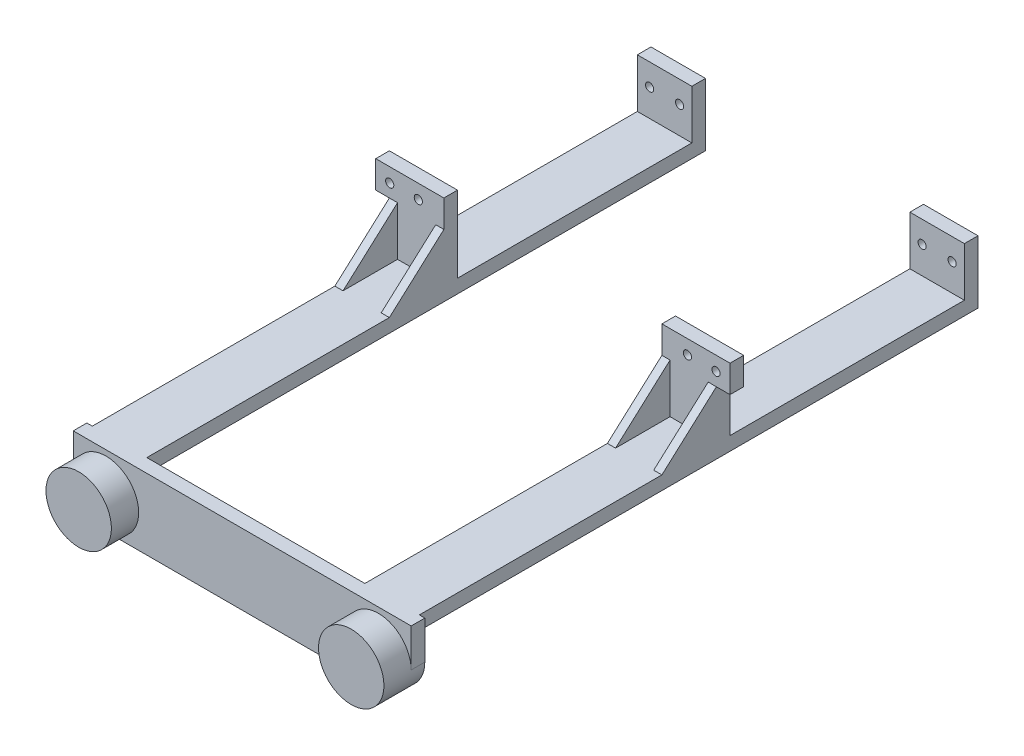
from build123d import *

# Parameters (mm, degrees)
SKETCH1_W               = 130
SKETCH1_H               = 24
BOSS_EXTRUDE1_DEPTH     = 5
CUT_EXTRUDE1_DEPTH      = 133.291345144
CUT_EXTRUDE1_DEPTH_BACK = 133.291345144
SKETCH2_R               = 6.5
SKETCH3_R               = 12
BOSS_EXTRUDE3_DEPTH     = 10
SKETCH4_R               = 6.5
CUT_EXTRUDE2_DEPTH      = 5
CUT_EXTRUDE3_DEPTH      = 133.574507353
CUT_EXTRUDE3_DEPTH_BACK = 133.574507353
BOSS_EXTRUDE4_DEPTH     = 2
SKETCH7_W               = 20
SKETCH7_H               = 5
BOSS_EXTRUDE5_DEPTH     = 205
SKETCH8_W               = 20
SKETCH8_H               = 5
BOSS_EXTRUDE6_DEPTH     = 28
SKETCH9_W               = 20
SKETCH9_H               = 5
BOSS_EXTRUDE7_DEPTH     = 18
SKETCH10_W              = 5
SKETCH10_H              = 10
BOSS_EXTRUDE8_DEPTH     = 25
SKETCH11_W              = 5
SKETCH11_H              = 10
BOSS_EXTRUDE9_DEPTH     = 25
SKETCH12_R              = 1.5
CUT_EXTRUDE4_DEPTH      = 188.59530911
THICKEN1_T2             = 3
THICKEN2_START          = 22
THICKEN2_DEPTH          = 3
THICKEN3_START          = 5
THICKEN3_DEPTH          = 3
THICKEN4_START          = 105
THICKEN4_DEPTH          = 3
CUT_EXTRUDE5_REACH      = 258.984
SKETCH14_R              = 1.5


# Read off the part's stored shape, not the designer's step: Thicken2, Thicken3, Thicken4
with BuildPart() as part:
    # Sketch1 → Boss-Extrude1 (new body)
    with BuildSketch(Plane.XY):
        with Locations((65, 12)):
            Rectangle(SKETCH1_W, SKETCH1_H)
    extrude(amount=BOSS_EXTRUDE1_DEPTH)

    # Sketch2 → Cut-Extrude1 (cut, two sides: drawn at the far end of the back side and taken through both)
    with BuildSketch(Plane(origin=(0, 0, 0), x_dir=(-1, 0, 0), z_dir=(0, 0, -1)).offset(-CUT_EXTRUDE1_DEPTH_BACK)):
        with Locations((-15, 12)):
            Circle(SKETCH2_R)
        with Locations((-115, 12)):
            Circle(SKETCH2_R)
    extrude(amount=CUT_EXTRUDE1_DEPTH + CUT_EXTRUDE1_DEPTH_BACK, mode=Mode.SUBTRACT)

    # Sketch3 → Boss-Extrude3 (add)
    with BuildSketch(Plane.XY.offset(5)):
        with Locations(Location((15, 12, 0), (0, 0, 270))):
            Circle(SKETCH3_R)
        with Locations(Location((115, 12, 0), (0, 0, 270))):
            Circle(SKETCH3_R)
    extrude(amount=BOSS_EXTRUDE3_DEPTH)

    # Sketch4 → Cut-Extrude2 (cut)
    with BuildSketch(Plane(origin=(0, 0, 5), x_dir=(-1, 0, 0), z_dir=(0, 0, -1))):
        with Locations((-15, 12)):
            Circle(SKETCH4_R)
        with Locations((-115, 12)):
            Circle(SKETCH4_R)
    extrude(amount=-CUT_EXTRUDE2_DEPTH, mode=Mode.SUBTRACT)

    # Sketch5 → Cut-Extrude3 (cut, two sides: drawn at the far end of the back side and taken through both)
    with BuildSketch(Plane.XY.offset(5).offset(-CUT_EXTRUDE3_DEPTH_BACK)):
        with BuildLine():
            Line((3, 24), (0, 24))
            Line((0, 24), (0, 0))
            Line((0, 0), (15, 0))
            ThreePointArc((15, 0), (6.514718626, 3.514718626), (3, 12))
            Line((3, 12), (3, 24))
        make_face()
        with BuildLine():
            Line((115, 0), (130, 0))
            Line((130, 0), (130, 24))
            Line((130, 24), (127, 24))
            Line((127, 24), (127, 12))
            ThreePointArc((127, 12), (123.485281374, 3.514718626), (115, 0))
        make_face()
    extrude(amount=CUT_EXTRUDE3_DEPTH + CUT_EXTRUDE3_DEPTH_BACK, mode=Mode.SUBTRACT)

    # Sketch6 → Boss-Extrude4 (add)
    with BuildSketch(Plane(origin=(0, 24, 0), x_dir=(1, 0, 0), z_dir=(0, 1, 0))):
        Polygon((127, 0), (3, 0), (3, -5), (15, -5), (115, -5), (127, -5), align=None)
    extrude(amount=BOSS_EXTRUDE4_DEPTH)

    # Sketch7 → Boss-Extrude5 (add)
    with BuildSketch(Plane(origin=(0, 0, 0), x_dir=(-1, 0, 0), z_dir=(0, 0, -1))):
        with Locations((-115, 23.5)):
            Rectangle(SKETCH7_W, SKETCH7_H)
        with Locations((-15, 23.5)):
            Rectangle(SKETCH7_W, SKETCH7_H)
    extrude(amount=BOSS_EXTRUDE5_DEPTH)

    # Sketch8 → Boss-Extrude6 (add)
    with BuildSketch(Plane(origin=(0, 26, 0), x_dir=(1, 0, 0), z_dir=(0, 1, 0))):
        with Locations((115, 111.5)):
            Rectangle(SKETCH8_W, SKETCH8_H)
        with Locations((15, 111.5)):
            Rectangle(SKETCH8_W, SKETCH8_H)
    extrude(amount=BOSS_EXTRUDE6_DEPTH)

    # Sketch9 → Boss-Extrude7 (add)
    with BuildSketch(Plane(origin=(0, 26, 0), x_dir=(1, 0, 0), z_dir=(0, 1, 0))):
        with Locations((115, 202.5)):
            Rectangle(SKETCH9_W, SKETCH9_H)
        with Locations((15, 202.5)):
            Rectangle(SKETCH9_W, SKETCH9_H)
    extrude(amount=BOSS_EXTRUDE7_DEPTH)

    # Sketch10 → Boss-Extrude8 (add)
    with BuildSketch(Plane.ZY.offset(-105)):
        with Locations((-111.5, 49)):
            Rectangle(SKETCH10_W, SKETCH10_H)
    extrude(amount=-BOSS_EXTRUDE8_DEPTH)

    # Sketch11 → Boss-Extrude9 (add)
    with BuildSketch(Plane(origin=(25, 0, 0), x_dir=(0, 0, -1), z_dir=(1, 0, 0))):
        with Locations((111.5, 49)):
            Rectangle(SKETCH11_W, SKETCH11_H)
    extrude(amount=-BOSS_EXTRUDE9_DEPTH)

    # Sketch12 → Cut-Extrude4 (cut, through all)
    with BuildSketch(Plane.XY.offset(-109)):
        with Locations((124.874085346, 48.801077027)):
            Circle(SKETCH12_R)
        with Locations((114.374085346, 48.801077027)):
            Circle(SKETCH12_R)
        with Locations((15.624085346, 48.801077027)):
            Circle(SKETCH12_R)
        with Locations((5.124085346, 48.801077027)):
            Circle(SKETCH12_R)
    extrude(amount=-CUT_EXTRUDE4_DEPTH, mode=Mode.SUBTRACT)

    # Sketch13 → Surface-Plane1: a flat surface bounded by the sketch
    with BuildSketch(Plane(origin=(125, 0, 0), x_dir=(0, 0, -1), z_dir=(1, 0, 0)), mode=Mode.PRIVATE) as surface_plane1_1_region:
        Polygon((109, 44), (109, 26), (89, 26), align=None)
    surface_plane1_1 = surface_plane1_1_region.sketch.faces()[0]
    add(Solid.thicken(surface_plane1_1, -THICKEN1_T2))

    # Thicken2 outline → Thicken2 (add)
    with BuildSketch(Plane.YZ.offset(THICKEN2_START)):
        Polygon((44, -109), (26, -89), (26, -109), align=None)
    extrude(amount=THICKEN2_DEPTH)

    # Thicken3 outline → Thicken3 (add)
    with BuildSketch(Plane.YZ.offset(THICKEN3_START)):
        Polygon((44, -109), (26, -89), (26, -109), align=None)
    extrude(amount=THICKEN3_DEPTH)

    # Thicken4 outline → Thicken4 (add)
    with BuildSketch(Plane.YZ.offset(THICKEN4_START)):
        Polygon((44, -109), (26, -89), (26, -109), align=None)
    extrude(amount=THICKEN4_DEPTH)

    # Sketch14 → Cut-Extrude5 (cut, up to next)
    with BuildSketch(Plane.XY.offset(-200), mode=Mode.PRIVATE) as cut_extrude5_sk1:
        with Locations((109.5, 36)):
            Circle(SKETCH14_R)
    cut_extrude5_tool1 = extrude(cut_extrude5_sk1.sketch, amount=-CUT_EXTRUDE5_REACH, mode=Mode.PRIVATE) & part.part
    # Sketch14 → Cut-Extrude5 (cut, up to next)
    with BuildSketch(Plane.XY.offset(-200), mode=Mode.PRIVATE) as cut_extrude5_sk2:
        with Locations((120.5, 36)):
            Circle(SKETCH14_R)
    cut_extrude5_tool2 = extrude(cut_extrude5_sk2.sketch, amount=-CUT_EXTRUDE5_REACH, mode=Mode.PRIVATE) & part.part
    # Sketch14 → Cut-Extrude5 (cut, up to next)
    with BuildSketch(Plane.XY.offset(-200), mode=Mode.PRIVATE) as cut_extrude5_sk3:
        with Locations((9.5, 36)):
            Circle(SKETCH14_R)
    cut_extrude5_tool3 = extrude(cut_extrude5_sk3.sketch, amount=-CUT_EXTRUDE5_REACH, mode=Mode.PRIVATE) & part.part
    # Sketch14 → Cut-Extrude5 (cut, up to next)
    with BuildSketch(Plane.XY.offset(-200), mode=Mode.PRIVATE) as cut_extrude5_sk4:
        with Locations((20.5, 36)):
            Circle(SKETCH14_R)
    cut_extrude5_tool4 = extrude(cut_extrude5_sk4.sketch, amount=-CUT_EXTRUDE5_REACH, mode=Mode.PRIVATE) & part.part
    add(cut_extrude5_tool1.solids().sort_by_distance((109.5, 36, -200))[0], mode=Mode.SUBTRACT)
    add(cut_extrude5_tool2.solids().sort_by_distance((120.5, 36, -200))[0], mode=Mode.SUBTRACT)
    add(cut_extrude5_tool3.solids().sort_by_distance((9.5, 36, -200))[0], mode=Mode.SUBTRACT)
    add(cut_extrude5_tool4.solids().sort_by_distance((20.5, 36, -200))[0], mode=Mode.SUBTRACT)


solid = part.part
